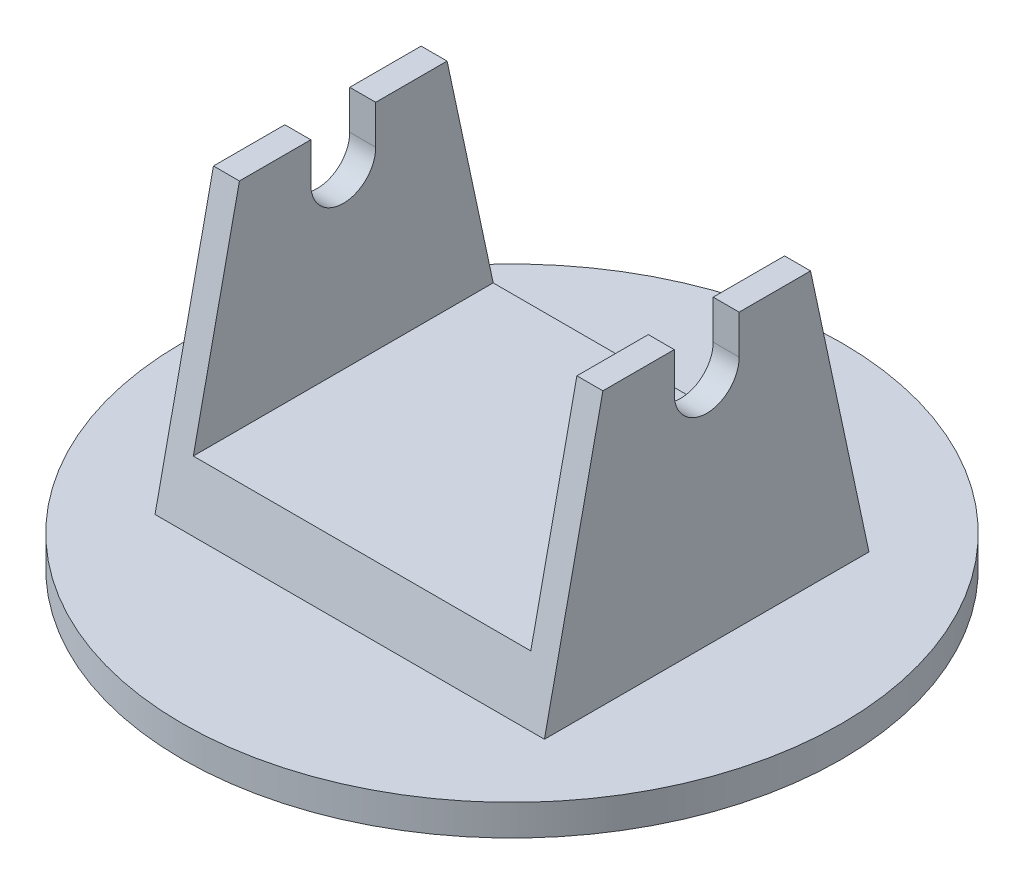
from build123d import *

# Parameters (mm, degrees)
SKETCH2_R               = 50.8
BOSS_EXTRUDE1_DEPTH     = 4.7625
BOSS_EXTRUDE2_DEPTH     = 30
CUT_EXTRUDE2_DEPTH      = 107.282695705
CUT_EXTRUDE1_DEPTH      = 86.720542499
CUT_EXTRUDE1_DEPTH_BACK = 86.720542499
SKETCH5_W               = 52
SKETCH5_H               = 33.1537


with BuildPart() as part:
    # Sketch2 → Boss-Extrude1 (new body)
    with BuildSketch(Plane(origin=(0, 0, 0), x_dir=(-1, 0, 0), z_dir=(0, 1, 0))):
        Circle(SKETCH2_R)
    extrude(amount=BOSS_EXTRUDE1_DEPTH)

    # Sketch4 → Boss-Extrude2 (add, symmetric)
    with BuildSketch(Plane(origin=(0, 0, 0), x_dir=(0, 0, -1), z_dir=(1, 0, 0))):
        Polygon((-25, 4.7625), (25, 4.7625), (16, 46.7625), (-16, 46.7625), align=None)
    extrude(amount=BOSS_EXTRUDE2_DEPTH, both=True)

    # Sketch6 → Cut-Extrude2 (cut, through all)
    with BuildSketch(Plane(origin=(30, 0, 0), x_dir=(0, 0, -1), z_dir=(1, 0, 0))):
        with BuildLine():
            Line((5, 40.7625), (5, 46.7625))
            Line((5, 46.7625), (-5, 46.7625))
            Line((-5, 46.7625), (-5, 40.7625))
            ThreePointArc((-5, 40.7625), (0, 35.7625), (5, 40.7625))
        make_face()
    extrude(amount=-CUT_EXTRUDE2_DEPTH, mode=Mode.SUBTRACT)

    # Sketch5 → Cut-Extrude1 (cut, two sides: drawn at the far end of the back side and taken through both)
    with BuildSketch(Plane.XY.offset(-CUT_EXTRUDE1_DEPTH_BACK)):
        with Locations((0, 30.18565)):
            Rectangle(SKETCH5_W, SKETCH5_H)
    extrude(amount=CUT_EXTRUDE1_DEPTH + CUT_EXTRUDE1_DEPTH_BACK, mode=Mode.SUBTRACT)


solid = part.part
